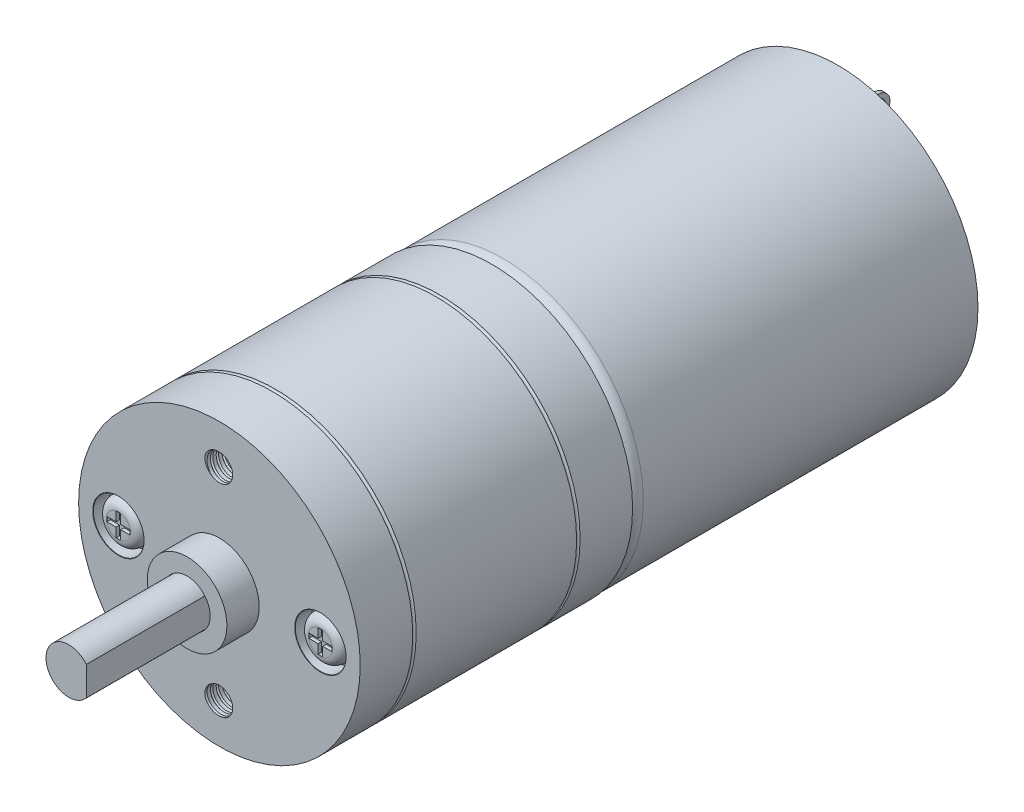
from build123d import *

# Parameters (mm, degrees)
SKETCH1_R                                  = 12.125
BOSS_EXTRUDE1_DEPTH                        = 30
SKETCH2_R                                  = 11.615
CUT_EXTRUDE1_DEPTH                         = 0.8
SKETCH3_R                                  = 3.25
BOSS_EXTRUDE2_DEPTH                        = 2.5
FILLET1_R                                  = 1
FILLET2_R                                  = 1
SHELL1_START                               = 1.8
SHELL1_OUTLINE_R                           = 11.125
SHELL1_DEPTH                               = 28.2
SHELL1_START_2                             = -0.7
SHELL1_2_OUTLINE_R                         = 2.25
SHELL1_2_DEPTH                             = 2.5
CUT_EXTRUDE3_DEPTH                         = 34.862534678
SKETCH5_R                                  = 0.6
CUT_EXTRUDE4_DEPTH                         = 34.862534678
SKETCH6_R                                  = 1.268409759
BOSS_EXTRUDE3_DEPTH                        = 0.3
SKETCH11_R                                 = 12.2
BOSS_EXTRUDE4_DEPTH                        = 23.6
SKETCH12_R                                 = 3.45
SKETCH12_R_2                               = 2
BOSS_EXTRUDE5_DEPTH                        = 2.8
SKETCH14_R                                 = 1.975
BOSS_EXTRUDE6_DEPTH                        = 13.05
CUT_EXTRUDE5_DEPTH                         = 13.05
SKETCH17_R                                 = 0.15
SKETCH18_R                                 = 1.15
CUT_EXTRUDE7_DEPTH                         = 10
CUT_SWEEP1_PITCH                           = 0.5
CBORE_FOR_M2_CHEESE_HEAD_SCREW1_AT_2_COUNT = 2
CBORE_FOR_M2_CHEESE_HEAD_SCREW1_AT_2_PITCH = 17.5
SKETCH24_R                                 = 1.842235559
BOSS_EXTRUDE7_DEPTH                        = 1.4
CUT_EXTRUDE9_DEPTH                         = 0.3
FILLET3_R                                  = 0.8
FILLET3_OF_MIRROR2_R                       = 0.8
SKETCH26_W                                 = 0.35
SKETCH26_H                                 = 2
BOSS_EXTRUDE8_DEPTH                        = 3
FILLET4_R                                  = 1
SKETCH27_R                                 = 0.6
CUT_EXTRUDE10_DEPTH                        = 3
SKETCH28_R                                 = 0.6
CUT_EXTRUDE11_DEPTH                        = 3


with BuildPart() as part:
    # Sketch1 → Boss-Extrude1 (new body)
    with BuildSketch(Plane.XY):
        Circle(SKETCH1_R)
    extrude(amount=BOSS_EXTRUDE1_DEPTH)

    # Sketch2 → Cut-Extrude1 (cut)
    with BuildSketch(Plane(origin=(0, 0, 0), x_dir=(-1, 0, 0), z_dir=(0, 0, -1))):
        Circle(SKETCH2_R)
    extrude(amount=-CUT_EXTRUDE1_DEPTH, mode=Mode.SUBTRACT)

    # Sketch3 → Boss-Extrude2 (add)
    with BuildSketch(Plane(origin=(0, 0, 0.8), x_dir=(-1, 0, 0), z_dir=(0, 0, -1))):
        Circle(SKETCH3_R)
    extrude(amount=BOSS_EXTRUDE2_DEPTH)

    # Fillet1
    fillet1_edges = [part.edges().sort_by_distance(p)[0] for p in [
        (3.25, 0, -1.7),
    ]]
    fillet(fillet1_edges, radius=FILLET1_R)

    # Fillet2
    fillet2_edges = [part.edges().sort_by_distance(p)[0] for p in [
        (-12.125, 0, 30),
    ]]
    fillet(fillet2_edges, radius=FILLET2_R)

    # Shell1: read off the stored shape, not the designer's step
    # Shell1 outline → Shell1 (cut)
    with BuildSketch(Plane.XY.offset(SHELL1_START)):
        Circle(SHELL1_OUTLINE_R)
    extrude(amount=SHELL1_DEPTH, mode=Mode.SUBTRACT)

    # Shell1 2 outline → Shell1 2 (cut)
    with BuildSketch(Plane.XY.offset(SHELL1_START_2)):
        Circle(SHELL1_2_OUTLINE_R)
    extrude(amount=SHELL1_2_DEPTH, mode=Mode.SUBTRACT)

    # Sketch4 → Cut-Extrude3 (cut, through all)
    with BuildSketch(Plane(origin=(0, 0, 0.8), x_dir=(-1, 0, 0), z_dir=(0, 0, -1))):
        with BuildLine():
            ThreePointArc((-1.308023114, 3.525149009), (-1.68397757, 3.758966893), (-1.551538055, 4.18142675))
            ThreePointArc((-1.551538055, 4.18142675), (0, 4.46), (1.551538055, 4.18142675))
            ThreePointArc((1.551538055, 4.18142675), (1.68397757, 3.758966893), (1.308023114, 3.525149009))
            ThreePointArc((1.308023114, 3.525149009), (0, 3.76), (-1.308023114, 3.525149009))
        make_face()
        with BuildLine():
            ThreePointArc((1.308023114, -3.525149009), (1.68397757, -3.758966893), (1.551538055, -4.18142675))
            ThreePointArc((1.551538055, -4.18142675), (0, -4.46), (-1.551538055, -4.18142675))
            ThreePointArc((-1.551538055, -4.18142675), (-1.68397757, -3.758966893), (-1.308023114, -3.525149009))
            ThreePointArc((-1.308023114, -3.525149009), (0, -3.76), (1.308023114, -3.525149009))
        make_face()
    extrude(amount=-CUT_EXTRUDE3_DEPTH, mode=Mode.SUBTRACT)

    # Sketch5 → Cut-Extrude4 (cut, through all)
    with BuildSketch(Plane(origin=(0, 0, 0.8), x_dir=(-1, 0, 0), z_dir=(0, 0, -1))):
        with Locations((4.392150153, 4.392150153)):
            Circle(SKETCH5_R)
        with Locations((-4.392150153, -4.392150153)):
            Circle(SKETCH5_R)
    extrude(amount=-CUT_EXTRUDE4_DEPTH, mode=Mode.SUBTRACT)

    # Sketch6 → Boss-Extrude3 (add)
    with BuildSketch(Plane(origin=(0, 0, 0.8), x_dir=(-1, 0, 0), z_dir=(0, 0, -1))):
        with Locations((5.180452667, 8.304610752)):
            Circle(SKETCH6_R)
        with Locations(Location((-5.180452667, 8.304610752, 0), (0, 0, 180))):
            Circle(SKETCH6_R)
        with Locations(Location((5.180452667, -8.304610752, 0), (0, 0, 180))):
            Circle(SKETCH6_R)
        with Locations((-5.180452667, -8.304610752)):
            Circle(SKETCH6_R)
        with BuildLine():
            Line((-2, 10.70066318), (2, 10.70066318))
            ThreePointArc((2, 10.70066318), (3.5, 9.20066318), (2, 7.70066318))
            Line((2, 7.70066318), (-2, 7.70066318))
            ThreePointArc((-2, 7.70066318), (-3.5, 9.20066318), (-2, 10.70066318))
        make_face()
        with BuildLine():
            Line((-2, -10.70066318), (2, -10.70066318))
            ThreePointArc((2, -10.70066318), (3.5, -9.20066318), (2, -7.70066318))
            Line((2, -7.70066318), (-2, -7.70066318))
            ThreePointArc((-2, -7.70066318), (-3.5, -9.20066318), (-2, -10.70066318))
        make_face()
    extrude(amount=BOSS_EXTRUDE3_DEPTH)

    # Sketch26 → Boss-Extrude8 (add)
    with BuildSketch(Plane(origin=(0, 0, 0.5), x_dir=(-1, 0, 0), z_dir=(0, 0, -1))):
        with Locations((1.776829535, -9.18627111)):
            Rectangle(SKETCH26_W, SKETCH26_H)
        with Locations((-1.825, 9.20066318)):
            Rectangle(SKETCH26_W, SKETCH26_H)
    extrude(amount=BOSS_EXTRUDE8_DEPTH)

    # Fillet4
    fillet4_edges = [part.edges().sort_by_distance(p)[0] for p in [
        (-1.776829535, -8.18627111, -2.5),
        (-1.776829535, -10.18627111, -2.5),
        (1.825, 10.20066318, -2.5),
        (1.825, 8.20066318, -2.5),
    ]]
    fillet(fillet4_edges, radius=FILLET4_R - 0.0001)  # a hair under: the kernel refuses the full size

    # Sketch27 → Cut-Extrude10 (cut)
    with BuildSketch(Plane.ZY.offset(1.951829535)):
        with Locations(Location((-1.5, -9.18627111, 0), (0, 0, 270))):
            Circle(SKETCH27_R)
    extrude(amount=-CUT_EXTRUDE10_DEPTH, mode=Mode.SUBTRACT)

    # Sketch28 → Cut-Extrude11 (cut)
    with BuildSketch(Plane(origin=(2, 0, 0), x_dir=(0, 0, -1), z_dir=(1, 0, 0))):
        with Locations(Location((1.5, 9.20066318, 0), (0, 0, 90))):
            Circle(SKETCH28_R)
    extrude(amount=-CUT_EXTRUDE11_DEPTH, mode=Mode.SUBTRACT)


with BuildPart() as body_2:
    # Sketch11 → Boss-Extrude4 (new body)
    with BuildSketch(Plane.XY.offset(30)):
        Circle(SKETCH11_R)
    extrude(amount=BOSS_EXTRUDE4_DEPTH)

    # Sketch12 → Boss-Extrude5 (add)
    with BuildSketch(Plane.XY.offset(53.6)):
        Circle(SKETCH12_R)
        Circle(SKETCH12_R_2, mode=Mode.SUBTRACT)
    extrude(amount=BOSS_EXTRUDE5_DEPTH)

    # Sketch14 → Boss-Extrude6 (add)
    with BuildSketch(Plane.XY.offset(53.6)):
        Circle(SKETCH14_R)
    extrude(amount=BOSS_EXTRUDE6_DEPTH)

    # Sketch16 → Cut-Extrude5 (cut)
    with BuildSketch(Plane.XY.offset(66.65)):
        with BuildLine():
            Line((1.525, 0), (1.525, 1.25499004))
            ThreePointArc((1.525, 1.25499004), (1.975, 0), (1.525, -1.25499004))
            Line((1.525, -1.25499004), (1.525, 0))
        make_face()
    extrude(amount=-CUT_EXTRUDE5_DEPTH, mode=Mode.SUBTRACT)

    # Sketch17 → Cut-Revolve1 (revolve, cut)
    with BuildSketch(Plane(origin=(0, 0, 0), x_dir=(1, 0, 0), z_dir=(0, 1, 0))):
        with Locations((-12.2, -48.9)):
            Circle(SKETCH17_R)
        with Locations((-12.2, -34.7)):
            Circle(SKETCH17_R)
    revolve(axis=Axis((0, 0, 53.6), (0, 0, -1)), mode=Mode.SUBTRACT)

    # Sketch18 → Cut-Extrude7 (cut)
    with BuildSketch(Plane.XY.offset(53.6)):
        with Locations((0, 8.75)):
            Circle(SKETCH18_R)
        with Locations(Location((0, -8.75, 0), (0, 0, 180))):
            Circle(SKETCH18_R)
    extrude(amount=-CUT_EXTRUDE7_DEPTH, mode=Mode.SUBTRACT)

    # Cut-Sweep1: arcs per turn and ends read off the stored shape
    # Cut-Sweep1: the profile of Sketch19 profile screwed along a right-hand helix through 12 turns, 6 arcs to a turn; built about Z, then put on its axis
    cut_sweep1_z = Axis((0, 0, 0), (0, 0, 1))
    cut_sweep1_corners = [(1.1497, 0, -0.375238554), (1.282850719, 0, -0.269359623), (1.1497, 0, -0.173765365)]
    with BuildLine(mode=Mode.PRIVATE) as cut_sweep1_profile:
        Line(cut_sweep1_corners[0], cut_sweep1_corners[1])
        Line(cut_sweep1_corners[1], cut_sweep1_corners[2])
        Line(cut_sweep1_corners[2], cut_sweep1_corners[0])
    cut_sweep1_cap = Face(cut_sweep1_profile.wire())
    cut_sweep1_turn_angles = [0, 30, 60, 90, 120, 150, 180, 210, 240, 270, 300, 330, 360]
    cut_sweep1_turn_weights = [1, 0.8660254037844387, 1, 0.8660254037844387, 1, 0.8660254037844387, 1, 0.8660254037844387, 1, 0.8660254037844387, 1, 0.8660254037844387, 1]
    cut_sweep1_turn_rails = [Edge.make_bspline([Vector(p[0], p[1], 0).rotate(cut_sweep1_z, cut_sweep1_turn_angles[k]) / cut_sweep1_turn_weights[k] + Vector(0, 0, p[2] + CUT_SWEEP1_PITCH * cut_sweep1_turn_angles[k] / 360) for k in range(13)], [0, 0, 0, 1, 1, 2, 2, 3, 3, 4, 4, 5, 5, 6, 6, 6], 2, cut_sweep1_turn_weights) for p in cut_sweep1_corners]
    cut_sweep1_turn_sides = [Face.make_surface_from_curves(cut_sweep1_turn_rails[p[0]], cut_sweep1_turn_rails[p[1]]) for p in [(0, 1), (1, 2), (2, 0)]]
    cut_sweep1 = Plane(origin=(0, 8.75, 53.6), x_dir=(1, 0, 0), z_dir=(0, 0, -1)) * Solid(Shell([*[p.moved(Location((0, 0, CUT_SWEEP1_PITCH * i))) for i in range(12) for p in cut_sweep1_turn_sides], cut_sweep1_cap, cut_sweep1_cap.rotate(cut_sweep1_z, 4320).moved(Location((0, 0, CUT_SWEEP1_PITCH * 4320 / 360)))]))
    add(cut_sweep1, mode=Mode.SUBTRACT)

    # Mirror1: Cut-Sweep1 across plane
    add(cut_sweep1.mirror(Plane.ZX), mode=Mode.SUBTRACT)

    # Sketch23 → CBORE for M2 Cheese Head Screw1 (revolve, cut)
    with BuildSketch(Plane(origin=(-8.75, 0, 53.6), x_dir=(0, -1, 0), z_dir=(1, 0, 0))):
        Polygon((0, 0), (0, 5.781118805), (1.3, 5), (1.3, 1.4), (2.2, 1.4), (2.2, 0.025), (2.225, 0), align=None)
    cbore_for_m2_cheese_head_screw1 = revolve(axis=Axis((-8.75, 0, 59.95), (0, 0, -1)), mode=Mode.SUBTRACT)

    # CBORE for M2 Cheese Head Screw1 at 2: CBORE for M2 Cheese Head Screw1 ×2
    with Locations(*[(i * CBORE_FOR_M2_CHEESE_HEAD_SCREW1_AT_2_PITCH, 0, 0) for i in range(1, CBORE_FOR_M2_CHEESE_HEAD_SCREW1_AT_2_COUNT)]):
        add(cbore_for_m2_cheese_head_screw1, mode=Mode.SUBTRACT)

    # Sketch24 → Boss-Extrude7 (add)
    with BuildSketch(Plane.XY.offset(52.2)):
        with Locations(Location((-8.75, 0, 0), (0, 0, 180))):
            Circle(SKETCH24_R)
    boss_extrude7 = extrude(amount=BOSS_EXTRUDE7_DEPTH)

    # Sketch25 → Cut-Extrude9 (cut)
    with BuildSketch(Plane.XY.offset(53.6)):
        Polygon((-8.55, 0.2), (-7.75, 0.2), (-7.75, -0.2), (-8.55, -0.2), (-8.55, -1), (-8.95, -1), (-8.95, -0.2), (-9.75, -0.2), (-9.75, 0.2), (-8.95, 0.2), (-8.95, 1), (-8.55, 1), align=None)
    cut_extrude9 = extrude(amount=-CUT_EXTRUDE9_DEPTH, mode=Mode.SUBTRACT)

    # Fillet3
    fillet3_edges = [body_2.edges().sort_by_distance(p)[0] for p in [
        (-6.907764441, 0, 53.6),
    ]]
    fillet(fillet3_edges, radius=FILLET3_R)

    # Mirror2: Boss-Extrude7, Cut-Extrude9 across plane
    add(boss_extrude7.mirror(Plane(origin=(0, 0, 0), x_dir=(0, 0, 1), z_dir=(1, 0, 0))))
    add(cut_extrude9.mirror(Plane(origin=(0, 0, 0), x_dir=(0, 0, 1), z_dir=(1, 0, 0))), mode=Mode.SUBTRACT)

    # Fillet3 of Mirror2
    fillet3_of_mirror2_edges = [body_2.edges().sort_by_distance(p)[0] for p in [
        (6.907764441, 0, 53.6),
    ]]
    fillet(fillet3_of_mirror2_edges, radius=FILLET3_OF_MIRROR2_R)


solid = Compound([part.part, body_2.part])
